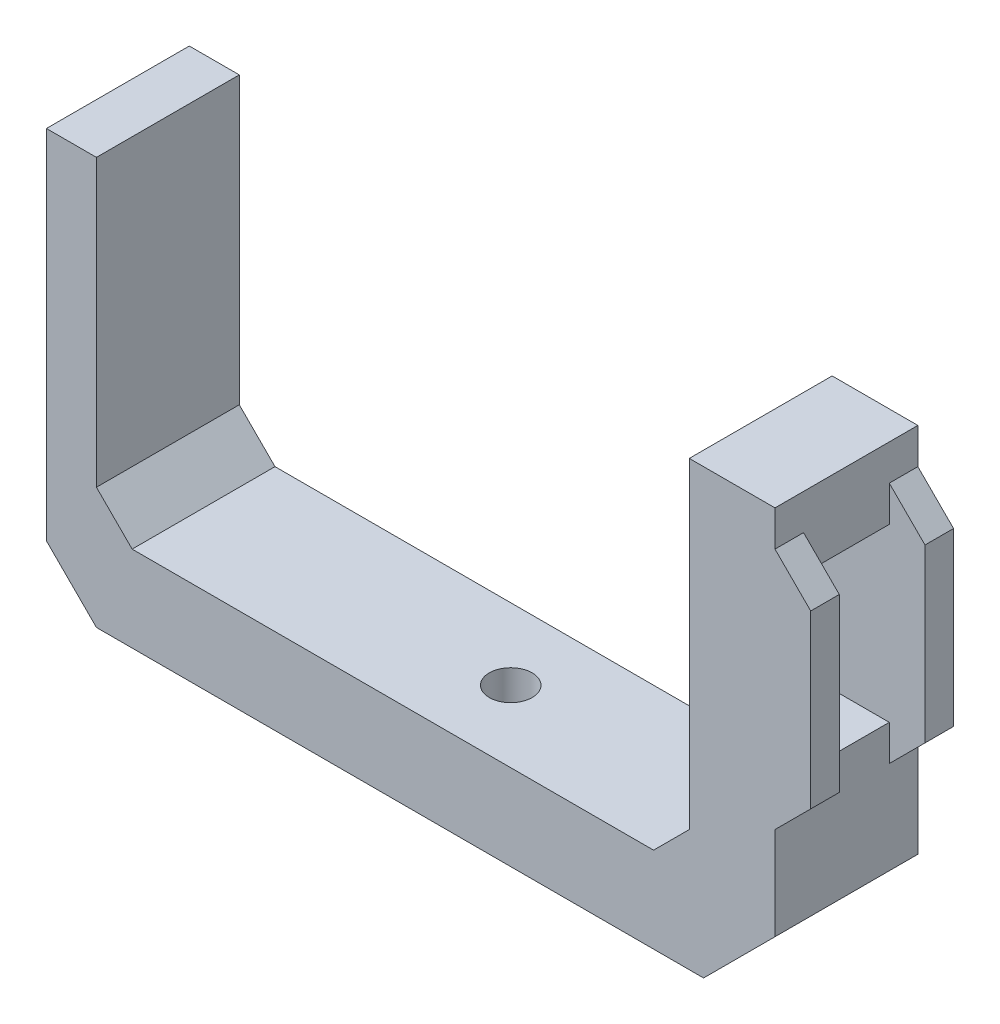
from build123d import *

# Parameters (mm, degrees)
BOSS_EXTRUDE1_DEPTH = 20
CHAMFER1_SIZE       = 5
CHAMFER2_SIZE       = 10
SKETCH2_R           = 1.75
CUT_EXTRUDE1_DEPTH  = 20
SKETCH3_R           = 3
CUT_EXTRUDE2_DEPTH  = 10
BOSS_EXTRUDE2_START = 2
SKETCH4_R           = 3
BOSS_EXTRUDE2_DEPTH = 2
SKETCH5_R           = 1
CUT_EXTRUDE3_DEPTH  = 2
SKETCH6_W           = 12
SKETCH6_H           = 24
CUT_EXTRUDE4_DEPTH  = 12
SKETCH7_W           = 4
SKETCH7_H           = 24
BOSS_EXTRUDE3_DEPTH = 5
CHAMFER3_SIZE       = 5
SKETCH8_W           = 20
SKETCH8_H           = 12
BOSS_EXTRUDE4_DEPTH = 45
SKETCH9_W           = 7
SKETCH9_H           = 20
BOSS_EXTRUDE5_DEPTH = 45
CHAMFER4_SIZE       = 5
CHAMFER5_SIZE       = 7


with BuildPart() as part:
    # Sketch1 → Boss-Extrude1 (new body)
    with BuildSketch(Plane.XY):
        Polygon((16.2, 38.12), (28.2, 38.12), (28.2, -23.88), (-28.8, -23.88), (-28.8, -11.88), (16.2, -11.88), align=None)
    extrude(amount=BOSS_EXTRUDE1_DEPTH)

    # Chamfer1
    chamfer1_edges = [part.edges().sort_by_distance(p)[0] for p in [
        (16.2, -11.88, 10),
    ]]
    chamfer(chamfer1_edges, length=CHAMFER1_SIZE)

    # Chamfer2
    chamfer2_edges = [part.edges().sort_by_distance(p)[0] for p in [
        (28.2, -23.88, 10),
    ]]
    chamfer(chamfer2_edges, length=CHAMFER2_SIZE)

    # Sketch2 → Cut-Extrude1 (cut)
    with BuildSketch(Plane(origin=(0, -11.88, 0), x_dir=(1, 0, 0), z_dir=(0, 1, 0))):
        with Locations(Location((-18.8, -10, 0), (0, 0, 270))):
            Circle(SKETCH2_R)
    extrude(amount=-CUT_EXTRUDE1_DEPTH, mode=Mode.SUBTRACT)

    # Sketch3 → Cut-Extrude2 (cut)
    with BuildSketch(Plane(origin=(0, -11.88, 0), x_dir=(1, 0, 0), z_dir=(0, 1, 0))):
        with Locations(Location((-18.8, -10, 0), (0, 0, 270))):
            Circle(SKETCH3_R)
    extrude(amount=-CUT_EXTRUDE2_DEPTH, mode=Mode.SUBTRACT)

    # Sketch4 → Boss-Extrude2 (add)
    with BuildSketch(Plane(origin=(0, -21.88, 0), x_dir=(1, 0, 0), z_dir=(0, 1, 0)).offset(BOSS_EXTRUDE2_START)):
        with Locations(Location((-18.8, -10, 0), (0, 0, 270))):
            Circle(SKETCH4_R)
    extrude(amount=-BOSS_EXTRUDE2_DEPTH)

    # Sketch5 → Cut-Extrude3 (cut)
    with BuildSketch(Plane(origin=(0, -19.88, 0), x_dir=(1, 0, 0), z_dir=(0, 1, 0))):
        with Locations(Location((-18.8, -10, 0), (0, 0, 270))):
            Circle(SKETCH5_R)
    extrude(amount=-CUT_EXTRUDE3_DEPTH, mode=Mode.SUBTRACT)

    # Sketch6 → Cut-Extrude4 (cut)
    with BuildSketch(Plane.ZY.offset(-16.2)):
        with Locations((10, 16.12)):
            Rectangle(SKETCH6_W, SKETCH6_H)
    extrude(amount=-CUT_EXTRUDE4_DEPTH, mode=Mode.SUBTRACT)

    # Sketch7 → Boss-Extrude3 (add)
    with BuildSketch(Plane(origin=(28.2, 0, 0), x_dir=(0, 0, -1), z_dir=(1, 0, 0))):
        with Locations((-18, 16.12)):
            Rectangle(SKETCH7_W, SKETCH7_H)
        with Locations((-2, 16.12)):
            Rectangle(SKETCH7_W, SKETCH7_H)
    extrude(amount=BOSS_EXTRUDE3_DEPTH)

    # Chamfer3
    chamfer3_edges = [part.edges().sort_by_distance(p)[0] for p in [
        (28.2, 4.12, 18),
        (28.2, 4.12, 2),
        (28.2, 28.12, 18),
        (28.2, 28.12, 2),
    ]]
    chamfer(chamfer3_edges, length=CHAMFER3_SIZE - 0.0001)  # a hair under: the kernel refuses the full size

    # Sketch8 → Boss-Extrude4 (add)
    with BuildSketch(Plane.ZY.offset(28.8)):
        with Locations((10, -17.88)):
            Rectangle(SKETCH8_W, SKETCH8_H)
    extrude(amount=BOSS_EXTRUDE4_DEPTH)

    # Sketch9 → Boss-Extrude5 (add)
    with BuildSketch(Plane(origin=(0, -11.88, 0), x_dir=(1, 0, 0), z_dir=(0, 1, 0))):
        with Locations((-70.3, -10)):
            Rectangle(SKETCH9_W, SKETCH9_H)
    extrude(amount=BOSS_EXTRUDE5_DEPTH)

    # Chamfer4
    chamfer4_edges = [part.edges().sort_by_distance(p)[0] for p in [
        (-66.8, -11.88, 10),
    ]]
    chamfer(chamfer4_edges, length=CHAMFER4_SIZE)

    # Chamfer5
    chamfer5_edges = [part.edges().sort_by_distance(p)[0] for p in [
        (-73.8, -23.88, 10),
    ]]
    chamfer(chamfer5_edges, length=CHAMFER5_SIZE)


solid = part.part
